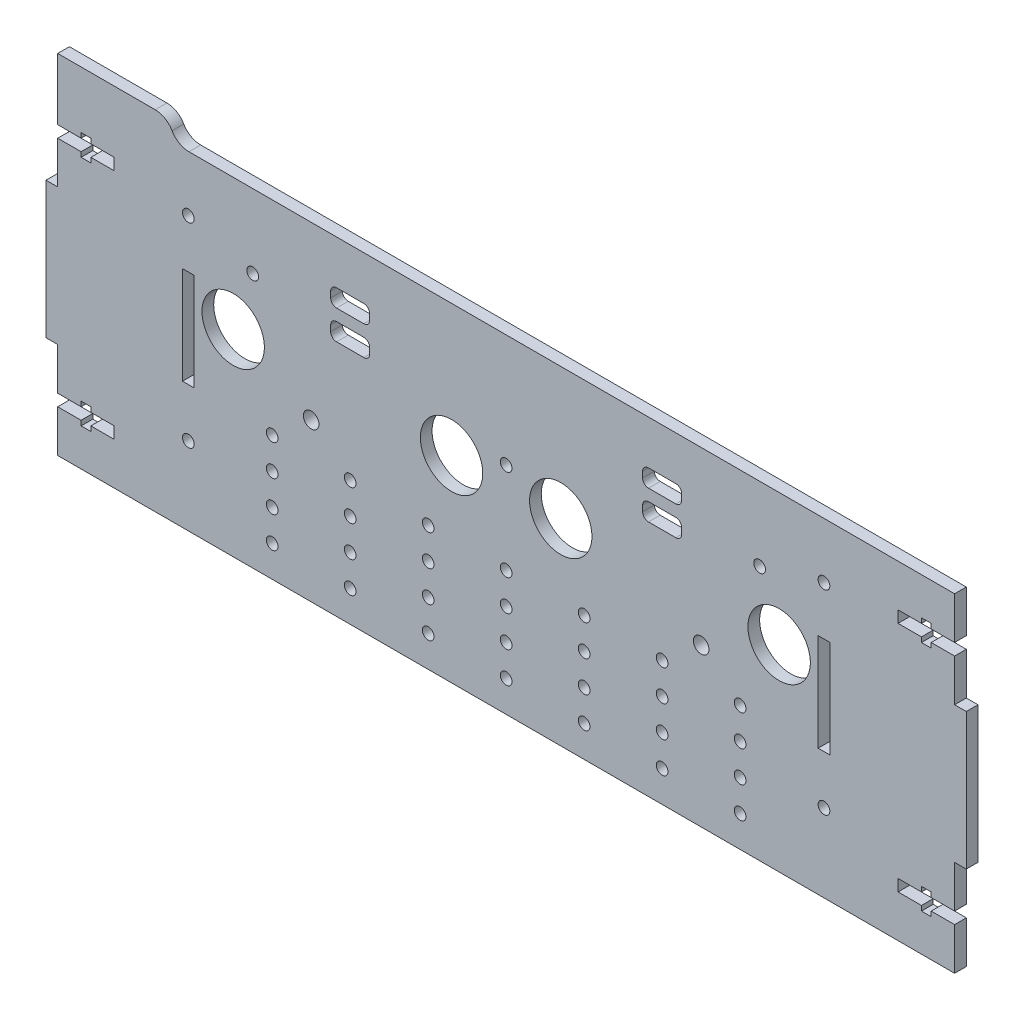
from build123d import *

# Parameters (mm, degrees)
SKETCH_1_W                  = 230
SKETCH_1_H                  = 84.29
EXTRUDE_1_DEPTH             = 3
EXTRUDE_2_DEPTH             = 3
EXTRUDE_2_DEPTH_BACK        = 233
SKETCH_3_W                  = 3
SKETCH_3_H                  = 35
SKETCH_2_R                  = 2
CUT_EXTRUDE_1_DEPTH         = 3
SKETCH_5_R                  = 1.5
CUT_EXTRUDE_2_DEPTH         = 3
SKETCH_6_W                  = 3
SKETCH_6_H                  = 25
CUT_EXTRUDE_3_DEPTH         = 3
CUT_EXTRUDE_4_DEPTH         = 3
SKETCH_8_W                  = 30
SKETCH_8_H                  = 3
EXTRUDE_3_DEPTH             = 5
FILLET_1_R                  = 5
FILLET_2_R                  = 5
SKETCH_9_R                  = 1.5
CUT_EXTRUDE_5_DEPTH         = 10
SKETCH_10_R                 = 8
CUT_EXTRUDE_6_DEPTH         = 10
SKETCH_11_W                 = 10
SKETCH_11_H                 = 4.5
CUT_EXTRUDE_7_DEPTH         = 10
FILLET_3_R                  = 1.5
SKETCH_12_R                 = 1.5
CUT_EXTRUDE_8_DEPTH         = 10
PATTERN_LINEAR_1_COUNT      = 7
PATTERN_LINEAR_1_PITCH      = 20
PATTERN_LINEAR_1_COUNT_DIR2 = 4
PATTERN_LINEAR_1_PITCH_DIR2 = 8


with BuildPart() as part:
    # Эскиз1 → Бобышка-Вытянуть1 (new body)
    with BuildSketch(Plane.XY):
        with Locations((115, 42.145)):
            Rectangle(SKETCH_1_W, SKETCH_1_H)
    extrude(amount=EXTRUDE_1_DEPTH)

    # Эскиз3 → Бобышка-Вытянуть2 (add, two sides: drawn at the far end of the back side and taken through both)
    with BuildSketch(Plane(origin=(230, 0, 0), x_dir=(0, 0, -1), z_dir=(1, 0, 0)).offset(-EXTRUDE_2_DEPTH_BACK)):
        with Locations((-1.5, 42.145)):
            Rectangle(SKETCH_3_W, SKETCH_3_H)
    extrude(amount=EXTRUDE_2_DEPTH + EXTRUDE_2_DEPTH_BACK)

    # Эскиз2 → Вырез-Вытянуть1 (cut)
    with BuildSketch(Plane.XY.offset(3)):
        with Locations((65, 40.4)):
            Circle(SKETCH_2_R)
        with Locations((165, 40.4)):
            Circle(SKETCH_2_R)
    extrude(amount=-CUT_EXTRUDE_1_DEPTH, mode=Mode.SUBTRACT)

    # Эскиз5 → Вырез-Вытянуть2 (cut)
    with BuildSketch(Plane.XY.offset(3)):
        with Locations((33.5, 70)):
            Circle(SKETCH_5_R)
        with Locations((33.5, 20)):
            Circle(SKETCH_5_R)
        with Locations((196.5, 20)):
            Circle(SKETCH_5_R)
        with Locations((196.5, 70)):
            Circle(SKETCH_5_R)
    extrude(amount=-CUT_EXTRUDE_2_DEPTH, mode=Mode.SUBTRACT)

    # Эскиз6 → Вырез-Вытянуть3 (cut)
    with BuildSketch(Plane.XY.offset(3)):
        with Locations((33.5, 45)):
            Rectangle(SKETCH_6_W, SKETCH_6_H)
        with Locations((196.5, 45)):
            Rectangle(SKETCH_6_W, SKETCH_6_H)
    extrude(amount=-CUT_EXTRUDE_3_DEPTH, mode=Mode.SUBTRACT)

    # Эскиз7 → Вырез-Вытянуть4 (cut)
    with BuildSketch(Plane.XY.offset(3)):
        Polygon((0, 73.4675), (6, 73.4675), (6, 74.7175), (8.5, 74.7175), (8.5, 73.4675), (14.5, 73.4675), (14.5, 70.4675), (8.5, 70.4675), (8.5, 69.2175), (6, 69.2175), (6, 70.4675), (0, 70.4675), align=None)
        Polygon((0, 13.8225), (0, 10.8225), (6, 10.8225), (6, 9.5725), (8.5, 9.5725), (8.5, 10.8225), (14.5, 10.8225), (14.5, 13.8225), (8.5, 13.8225), (8.5, 15.0725), (6, 15.0725), (6, 13.8225), align=None)
        Polygon((230, 10.8225), (224, 10.8225), (224, 9.5725), (221.5, 9.5725), (221.5, 10.8225), (215.5, 10.8225), (215.5, 13.8225), (221.5, 13.8225), (221.5, 15.0725), (224, 15.0725), (224, 13.8225), (230, 13.8225), align=None)
        Polygon((230, 70.4675), (230, 73.4675), (224, 73.4675), (224, 74.7175), (221.5, 74.7175), (221.5, 73.4675), (215.5, 73.4675), (215.5, 70.4675), (221.5, 70.4675), (221.5, 69.2175), (224, 69.2175), (224, 70.4675), align=None)
    extrude(amount=-CUT_EXTRUDE_4_DEPTH, mode=Mode.SUBTRACT)

    # Эскиз8 → Бобышка-Вытянуть3 (add)
    with BuildSketch(Plane(origin=(0, 84.29, 0), x_dir=(1, 0, 0), z_dir=(0, 1, 0))):
        with Locations((15, -1.5)):
            Rectangle(SKETCH_8_W, SKETCH_8_H)
    extrude(amount=EXTRUDE_3_DEPTH)

    # Скругление1
    fillet_1_edges = [part.edges().sort_by_distance(p)[0] for p in [
        (30, 89.29, 1.5),
    ]]
    fillet(fillet_1_edges, radius=FILLET_1_R - 0.0001)  # a hair under: the kernel refuses the full size

    # Скругление2
    fillet_2_edges = [part.edges().sort_by_distance(p)[0] for p in [
        (30, 84.29, 1.5),
    ]]
    fillet(fillet_2_edges, radius=FILLET_2_R)

    # Эскиз9 → Вырез-Вытянуть5 (cut)
    with BuildSketch(Plane(origin=(0, 0, 0), x_dir=(-1, 0, 0), z_dir=(0, 0, -1))):
        with Locations((-180, 65.4)):
            Circle(SKETCH_9_R)
        with Locations((-50, 65.4)):
            Circle(SKETCH_9_R)
        with Locations((-115, 55.4)):
            Circle(SKETCH_9_R)
    extrude(amount=-CUT_EXTRUDE_5_DEPTH, mode=Mode.SUBTRACT)

    # Эскиз10 → Вырез-Вытянуть6 (cut)
    with BuildSketch(Plane(origin=(0, 0, 0), x_dir=(-1, 0, 0), z_dir=(0, 0, -1))):
        with Locations((-185, 50.5)):
            Circle(SKETCH_10_R)
        with Locations((-129, 50.5)):
            Circle(SKETCH_10_R)
        with Locations((-101, 50.5)):
            Circle(SKETCH_10_R)
        with Locations((-45, 50.5)):
            Circle(SKETCH_10_R)
    extrude(amount=-CUT_EXTRUDE_6_DEPTH, mode=Mode.SUBTRACT)

    # Эскиз11 → Вырез-Вытянуть7 (cut)
    with BuildSketch(Plane(origin=(0, 0, 0), x_dir=(-1, 0, 0), z_dir=(0, 0, -1))):
        with Locations((-155, 63.25)):
            Rectangle(SKETCH_11_W, SKETCH_11_H)
        with Locations((-75, 63.25)):
            Rectangle(SKETCH_11_W, SKETCH_11_H)
        with Locations((-75, 70.75)):
            Rectangle(SKETCH_11_W, SKETCH_11_H)
        with Locations((-155, 70.75)):
            Rectangle(SKETCH_11_W, SKETCH_11_H)
    extrude(amount=-CUT_EXTRUDE_7_DEPTH, mode=Mode.SUBTRACT)

    # Скругление3
    fillet_3_edges = [part.edges().sort_by_distance(p)[0] for p in [
        (160, 61, 1.5),
        (160, 65.5, 1.5),
        (150, 65.5, 1.5),
        (150, 61, 1.5),
        (80, 61, 1.5),
        (80, 65.5, 1.5),
        (70, 65.5, 1.5),
        (70, 61, 1.5),
        (70, 73, 1.5),
        (70, 68.5, 1.5),
        (80, 68.5, 1.5),
        (80, 73, 1.5),
        (150, 73, 1.5),
        (150, 68.5, 1.5),
        (160, 68.5, 1.5),
        (160, 73, 1.5),
    ]]
    fillet(fillet_3_edges, radius=FILLET_3_R)

    # Эскиз12 → Вырез-Вытянуть8 (cut)
    with BuildSketch(Plane.XY.offset(3)):
        with Locations((55, 8)):
            Circle(SKETCH_12_R)
    cut_extrude_8 = extrude(amount=-CUT_EXTRUDE_8_DEPTH, mode=Mode.SUBTRACT)

    # Линейный массив1: Cut-Extrude 8 7 × 4
    with Locations(*[(i * PATTERN_LINEAR_1_PITCH, j * PATTERN_LINEAR_1_PITCH_DIR2, 0) for i in range(PATTERN_LINEAR_1_COUNT) for j in range(PATTERN_LINEAR_1_COUNT_DIR2) if (i, j) != (0, 0)]):
        add(cut_extrude_8, mode=Mode.SUBTRACT)


solid = part.part
